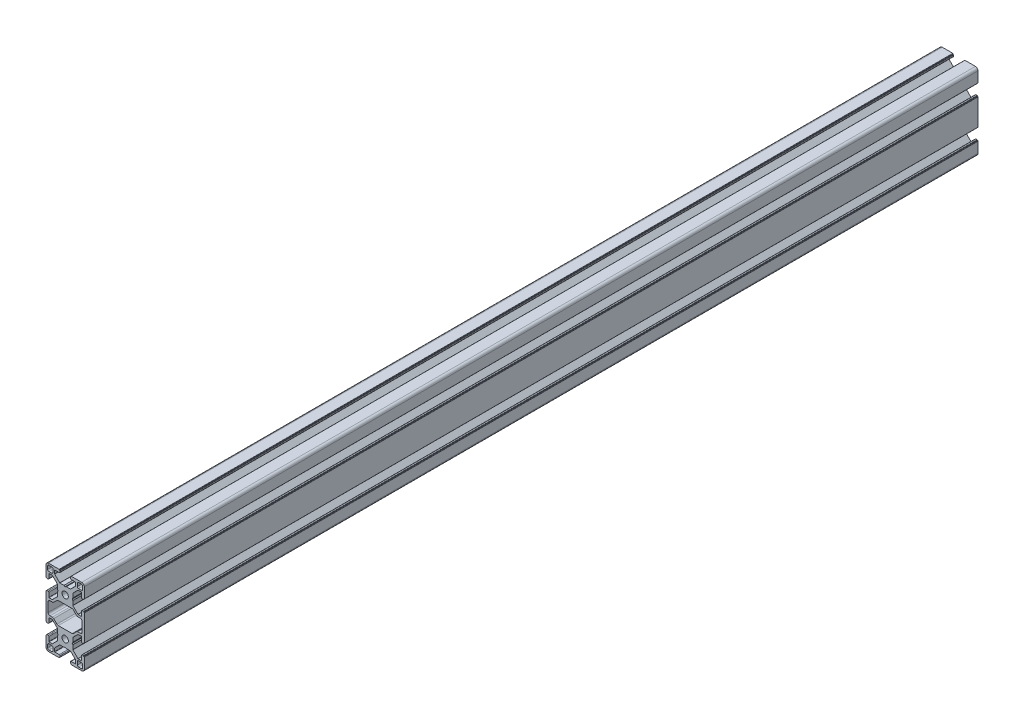
from build123d import *

# Parameters (mm, degrees)
SKETCH1_R                 = 2.45
BOSS_EXTRUDE1_DEPTH       = 700
SKETCH2_R                 = 3
CUT_EXTRUDE1_DEPTH        = 678.163200418
SKETCH3_R                 = 3
CUT_EXTRUDE2_DEPTH        = 678.827411761
M6X1_0_TAPPED_HOLE1_D     = 5
M6X1_0_TAPPED_HOLE1_DEPTH = 28
M6X1_0_TAPPED_HOLE1_TIP   = 1.502151548
M6X1_0_TAPPED_HOLE2_D     = 5
M6X1_0_TAPPED_HOLE2_DEPTH = 28
M6X1_0_TAPPED_HOLE2_TIP   = 1.502151548


with BuildPart() as part:
    # Sketch1 → Boss-Extrude1 (new body)
    with BuildSketch(Plane.XY.offset(25)):
        with BuildLine():
            Line((13.400000821, -25.95), (14.300000334, -25.95))
            ThreePointArc((14.300000334, -25.95), (14.44142169, -25.891421356), (14.500000334, -25.75))
            Line((14.500000334, -25.75), (14.500000334, -25.65))
            ThreePointArc((14.500000334, -25.65), (14.558578978, -25.508578644), (14.700000334, -25.45))
            Line((14.700000334, -25.45), (14.8, -25.45))
            ThreePointArc((14.8, -25.45), (14.941421356, -25.391421356), (15, -25.25))
            Line((15, -25.25), (15, -4.75))
            ThreePointArc((15, -4.75), (14.941421356, -4.608578644), (14.8, -4.55))
            Line((14.8, -4.55), (14.700000334, -4.55))
            ThreePointArc((14.700000334, -4.55), (14.558578978, -4.491421356), (14.500000334, -4.35))
            Line((14.500000334, -4.35), (14.500000334, -4.25))
            ThreePointArc((14.500000334, -4.25), (14.44142169, -4.108578644), (14.300000334, -4.05))
            Line((14.300000334, -4.05), (13.400000821, -4.05))
            ThreePointArc((13.400000821, -4.05), (12.975736752, -4.225735931), (12.800000821, -4.65))
            Line((12.800000821, -4.65), (12.800000821, -8.05))
            ThreePointArc((12.800000821, -8.05), (12.741422177, -8.191421356), (12.600000821, -8.25))
            Line((12.600000821, -8.25), (10.132847586, -8.25))
            ThreePointArc((10.132847586, -8.25), (10.056310912, -8.234775911), (9.991426248, -8.191421374))
            Line((9.991426248, -8.191421374), (6.06304592, -4.263042046))
            ThreePointArc((6.06304592, -4.263042046), (6.019691356, -4.19815737), (6.004467258, -4.121620672))
            Line((6.004467258, -4.121620672), (6.004467258, -0.90000009))
            Line((6.004467258, -0.90000009), (5.542586948, -0.099999736))
            ThreePointArc((5.542586948, -0.099999736), (5.515792105, 0), (5.542586948, 0.099999736))
            Line((5.542586948, 0.099999736), (6.004467258, 0.90000009))
            Line((6.004467258, 0.90000009), (6.004467258, 4.121623437))
            ThreePointArc((6.004467258, 4.121623437), (6.019691347, 4.198160112), (6.063045884, 4.263044775))
            Line((6.063045884, 4.263044775), (9.991421447, 8.191421338))
            ThreePointArc((9.991421447, 8.191421338), (10.056306123, 8.234775902), (10.132842821, 8.25))
            Line((10.132842821, 8.25), (12.600000821, 8.25))
            ThreePointArc((12.600000821, 8.25), (12.741422177, 8.191421356), (12.800000821, 8.05))
            Line((12.800000821, 8.05), (12.800000821, 4.65))
            ThreePointArc((12.800000821, 4.65), (12.975736752, 4.225735931), (13.400000821, 4.05))
            Line((13.400000821, 4.05), (14.300000334, 4.05))
            ThreePointArc((14.300000334, 4.05), (14.44142169, 4.108578644), (14.500000334, 4.25))
            Line((14.500000334, 4.25), (14.500000334, 4.350000125))
            ThreePointArc((14.500000334, 4.350000125), (14.558578978, 4.491421481), (14.700000334, 4.550000125))
            Line((14.700000334, 4.550000125), (14.8, 4.550000125))
            ThreePointArc((14.8, 4.550000125), (14.941421356, 4.608578769), (15, 4.750000125))
            Line((15, 4.750000125), (15, 13))
            ThreePointArc((15, 13), (14.414213562, 14.414213562), (13, 15))
            Line((13, 15), (4.75, 15))
            ThreePointArc((4.75, 15), (4.608578644, 14.941421356), (4.55, 14.8))
            Line((4.55, 14.8), (4.55, 14.7))
            ThreePointArc((4.55, 14.7), (4.491421356, 14.558578644), (4.35, 14.5))
            Line((4.35, 14.5), (4.25, 14.5))
            ThreePointArc((4.25, 14.5), (4.108578644, 14.441421356), (4.05, 14.3))
            Line((4.05, 14.3), (4.05, 13.4))
            ThreePointArc((4.05, 13.4), (4.225735931, 12.975735931), (4.65, 12.8))
            Line((4.65, 12.8), (8.05, 12.8))
            ThreePointArc((8.05, 12.8), (8.191421356, 12.741421356), (8.25, 12.6))
            Line((8.25, 12.6), (8.25, 10.132847492))
            ThreePointArc((8.25, 10.132847492), (8.234775904, 10.056310778), (8.191421344, 9.991426082))
            Line((8.191421344, 9.991426082), (4.258574852, 6.058578588))
            ThreePointArc((4.258574852, 6.058578588), (4.193690258, 6.015224079), (4.117153656, 6))
            Line((4.117153656, 6), (0.899999648, 6))
            Line((0.899999648, 6), (0.101934004, 5.53923672))
            ThreePointArc((0.101934004, 5.53923672), (0, 5.511923593), (-0.101934004, 5.53923672))
            Line((-0.101934004, 5.53923672), (-0.899999648, 6))
            Line((-0.899999648, 6), (-4.117156145, 6))
            ThreePointArc((-4.117156145, 6), (-4.193692724, 6.015224069), (-4.258577305, 6.058578552))
            Line((-4.258577305, 6.058578552), (-8.191421308, 9.991421554))
            ThreePointArc((-8.191421308, 9.991421554), (-8.234775894, 10.056306263), (-8.25, 10.132843))
            Line((-8.25, 10.132843), (-8.25, 12.6))
            ThreePointArc((-8.25, 12.6), (-8.191421356, 12.741421356), (-8.05, 12.8))
            Line((-8.05, 12.8), (-4.65, 12.8))
            ThreePointArc((-4.65, 12.8), (-4.225735931, 12.975735931), (-4.05, 13.4))
            Line((-4.05, 13.4), (-4.05, 14.3))
            ThreePointArc((-4.05, 14.3), (-4.108578644, 14.441421356), (-4.25, 14.5))
            Line((-4.25, 14.5), (-4.35, 14.5))
            ThreePointArc((-4.35, 14.5), (-4.491421356, 14.558578644), (-4.55, 14.7))
            Line((-4.55, 14.7), (-4.55, 14.8))
            ThreePointArc((-4.55, 14.8), (-4.608578644, 14.941421356), (-4.75, 15))
            Line((-4.75, 15), (-13, 15))
            ThreePointArc((-13, 15), (-14.414213562, 14.414213562), (-15, 13))
            Line((-15, 13), (-15, 4.750000125))
            ThreePointArc((-15, 4.750000125), (-14.941421356, 4.608578769), (-14.8, 4.550000125))
            Line((-14.8, 4.550000125), (-14.700000334, 4.550000125))
            ThreePointArc((-14.700000334, 4.550000125), (-14.558578978, 4.491421481), (-14.500000334, 4.350000125))
            Line((-14.500000334, 4.350000125), (-14.500000334, 4.25))
            ThreePointArc((-14.500000334, 4.25), (-14.44142169, 4.108578644), (-14.300000334, 4.05))
            Line((-14.300000334, 4.05), (-13.400000821, 4.05))
            ThreePointArc((-13.400000821, 4.05), (-12.975736752, 4.225735931), (-12.800000821, 4.65))
            Line((-12.800000821, 4.65), (-12.800000821, 8.05))
            ThreePointArc((-12.800000821, 8.05), (-12.741422177, 8.191421356), (-12.600000821, 8.25))
            Line((-12.600000821, 8.25), (-10.132842821, 8.25))
            ThreePointArc((-10.132842821, 8.25), (-10.056306123, 8.234775902), (-9.991421447, 8.191421338))
            Line((-9.991421447, 8.191421338), (-6.063045884, 4.263044775))
            ThreePointArc((-6.063045884, 4.263044775), (-6.019691347, 4.198160112), (-6.004467258, 4.121623437))
            Line((-6.004467258, 4.121623437), (-6.004467258, 0.90000009))
            Line((-6.004467258, 0.90000009), (-5.542586948, 0.099999736))
            ThreePointArc((-5.542586948, 0.099999736), (-5.515792105, 0), (-5.542586948, -0.099999736))
            Line((-5.542586948, -0.099999736), (-6.004467258, -0.90000009))
            Line((-6.004467258, -0.90000009), (-6.004467258, -4.121623437))
            ThreePointArc((-6.004467258, -4.121623437), (-6.019691347, -4.198160112), (-6.063045884, -4.263044775))
            Line((-6.063045884, -4.263044775), (-9.991421447, -8.191421338))
            ThreePointArc((-9.991421447, -8.191421338), (-10.056306123, -8.234775902), (-10.132842821, -8.25))
            Line((-10.132842821, -8.25), (-12.600000821, -8.25))
            ThreePointArc((-12.600000821, -8.25), (-12.741422177, -8.191421356), (-12.800000821, -8.05))
            Line((-12.800000821, -8.05), (-12.800000821, -4.65))
            ThreePointArc((-12.800000821, -4.65), (-12.975736752, -4.225735931), (-13.400000821, -4.05))
            Line((-13.400000821, -4.05), (-14.300000334, -4.05))
            ThreePointArc((-14.300000334, -4.05), (-14.44142169, -4.108578644), (-14.500000334, -4.25))
            Line((-14.500000334, -4.25), (-14.500000334, -4.35))
            ThreePointArc((-14.500000334, -4.35), (-14.558578978, -4.491421356), (-14.700000334, -4.55))
            Line((-14.700000334, -4.55), (-14.8, -4.55))
            ThreePointArc((-14.8, -4.55), (-14.941421356, -4.608578644), (-15, -4.75))
            Line((-15, -4.75), (-15, -25.25))
            ThreePointArc((-15, -25.25), (-14.941421356, -25.391421356), (-14.8, -25.45))
            Line((-14.8, -25.45), (-14.700000334, -25.45))
            ThreePointArc((-14.700000334, -25.45), (-14.558578978, -25.508578644), (-14.500000334, -25.65))
            Line((-14.500000334, -25.65), (-14.500000334, -25.75))
            ThreePointArc((-14.500000334, -25.75), (-14.44142169, -25.891421356), (-14.300000334, -25.95))
            Line((-14.300000334, -25.95), (-13.400000821, -25.95))
            ThreePointArc((-13.400000821, -25.95), (-12.975736752, -25.774264069), (-12.800000821, -25.35))
            Line((-12.800000821, -25.35), (-12.800000821, -21.95))
            ThreePointArc((-12.800000821, -21.95), (-12.741422177, -21.808578644), (-12.600000821, -21.75))
            Line((-12.600000821, -21.75), (-10.132842821, -21.75))
            ThreePointArc((-10.132842821, -21.75), (-10.056306123, -21.765224098), (-9.991421447, -21.808578662))
            Line((-9.991421447, -21.808578662), (-6.063045884, -25.736955225))
            ThreePointArc((-6.063045884, -25.736955225), (-6.019691347, -25.801839888), (-6.004467258, -25.878376563))
            Line((-6.004467258, -25.878376563), (-6.004467258, -29.09999991))
            Line((-6.004467258, -29.09999991), (-5.542586948, -29.900000264))
            ThreePointArc((-5.542586948, -29.900000264), (-5.515792105, -30), (-5.542586948, -30.099999736))
            Line((-5.542586948, -30.099999736), (-6.004467258, -30.90000009))
            Line((-6.004467258, -30.90000009), (-6.004467258, -34.121623437))
            ThreePointArc((-6.004467258, -34.121623437), (-6.019691347, -34.198160112), (-6.063045884, -34.263044775))
            Line((-6.063045884, -34.263044775), (-9.991421447, -38.191421338))
            ThreePointArc((-9.991421447, -38.191421338), (-10.056306123, -38.234775902), (-10.132842821, -38.25))
            Line((-10.132842821, -38.25), (-12.600000821, -38.25))
            ThreePointArc((-12.600000821, -38.25), (-12.741422177, -38.191421356), (-12.800000821, -38.05))
            Line((-12.800000821, -38.05), (-12.800000821, -34.65))
            ThreePointArc((-12.800000821, -34.65), (-12.975736752, -34.225735931), (-13.400000821, -34.05))
            Line((-13.400000821, -34.05), (-14.300000334, -34.05))
            ThreePointArc((-14.300000334, -34.05), (-14.44142169, -34.108578644), (-14.500000334, -34.25))
            Line((-14.500000334, -34.25), (-14.500000334, -34.350000125))
            ThreePointArc((-14.500000334, -34.350000125), (-14.558578978, -34.491421481), (-14.700000334, -34.550000125))
            Line((-14.700000334, -34.550000125), (-14.8, -34.550000125))
            ThreePointArc((-14.8, -34.550000125), (-14.941421356, -34.608578769), (-15, -34.750000125))
            Line((-15, -34.750000125), (-15, -43))
            ThreePointArc((-15, -43), (-14.414213562, -44.414213562), (-13, -45))
            Line((-13, -45), (-4.75, -45))
            ThreePointArc((-4.75, -45), (-4.608578644, -44.941421356), (-4.55, -44.8))
            Line((-4.55, -44.8), (-4.55, -44.7))
            ThreePointArc((-4.55, -44.7), (-4.491421356, -44.558578644), (-4.35, -44.5))
            Line((-4.35, -44.5), (-4.25, -44.5))
            ThreePointArc((-4.25, -44.5), (-4.108578644, -44.441421356), (-4.05, -44.3))
            Line((-4.05, -44.3), (-4.05, -43.4))
            ThreePointArc((-4.05, -43.4), (-4.225735931, -42.975735931), (-4.65, -42.8))
            Line((-4.65, -42.8), (-8.05, -42.8))
            ThreePointArc((-8.05, -42.8), (-8.191421356, -42.741421356), (-8.25, -42.6))
            Line((-8.25, -42.6), (-8.25, -40.132843))
            ThreePointArc((-8.25, -40.132843), (-8.234775894, -40.056306263), (-8.191421308, -39.991421554))
            Line((-8.191421308, -39.991421554), (-4.258577305, -36.058578552))
            ThreePointArc((-4.258577305, -36.058578552), (-4.193692724, -36.015224069), (-4.117156145, -36))
            Line((-4.117156145, -36), (-0.899999648, -36))
            Line((-0.899999648, -36), (-0.101934004, -35.53923672))
            ThreePointArc((-0.101934004, -35.53923672), (0, -35.511923593), (0.101934004, -35.53923672))
            Line((0.101934004, -35.53923672), (0.899999648, -36))
            Line((0.899999648, -36), (4.117153656, -36))
            ThreePointArc((4.117153656, -36), (4.193690258, -36.015224079), (4.258574852, -36.058578588))
            Line((4.258574852, -36.058578588), (8.191421344, -39.991426082))
            ThreePointArc((8.191421344, -39.991426082), (8.234775904, -40.056310778), (8.25, -40.132847492))
            Line((8.25, -40.132847492), (8.25, -42.6))
            ThreePointArc((8.25, -42.6), (8.191421356, -42.741421356), (8.05, -42.8))
            Line((8.05, -42.8), (4.65, -42.8))
            ThreePointArc((4.65, -42.8), (4.225735931, -42.975735931), (4.05, -43.4))
            Line((4.05, -43.4), (4.05, -44.3))
            ThreePointArc((4.05, -44.3), (4.108578644, -44.441421356), (4.25, -44.5))
            Line((4.25, -44.5), (4.35, -44.5))
            ThreePointArc((4.35, -44.5), (4.491421356, -44.558578644), (4.55, -44.7))
            Line((4.55, -44.7), (4.55, -44.8))
            ThreePointArc((4.55, -44.8), (4.608578644, -44.941421356), (4.75, -45))
            Line((4.75, -45), (13, -45))
            ThreePointArc((13, -45), (14.414213562, -44.414213562), (15, -43))
            Line((15, -43), (15, -34.750000125))
            ThreePointArc((15, -34.750000125), (14.941421356, -34.608578769), (14.8, -34.550000125))
            Line((14.8, -34.550000125), (14.700000334, -34.550000125))
            ThreePointArc((14.700000334, -34.550000125), (14.558578978, -34.491421481), (14.500000334, -34.350000125))
            Line((14.500000334, -34.350000125), (14.500000334, -34.25))
            ThreePointArc((14.500000334, -34.25), (14.44142169, -34.108578644), (14.300000334, -34.05))
            Line((14.300000334, -34.05), (13.400000821, -34.05))
            ThreePointArc((13.400000821, -34.05), (12.975736752, -34.225735931), (12.800000821, -34.65))
            Line((12.800000821, -34.65), (12.800000821, -38.05))
            ThreePointArc((12.800000821, -38.05), (12.741422177, -38.191421356), (12.600000821, -38.25))
            Line((12.600000821, -38.25), (10.132842821, -38.25))
            ThreePointArc((10.132842821, -38.25), (10.056306123, -38.234775902), (9.991421447, -38.191421338))
            Line((9.991421447, -38.191421338), (6.063045884, -34.263044775))
            ThreePointArc((6.063045884, -34.263044775), (6.019691347, -34.198160112), (6.004467258, -34.121623437))
            Line((6.004467258, -34.121623437), (6.004467258, -30.90000009))
            Line((6.004467258, -30.90000009), (5.542586948, -30.099999736))
            ThreePointArc((5.542586948, -30.099999736), (5.515792105, -30), (5.542586948, -29.900000264))
            Line((5.542586948, -29.900000264), (6.004467258, -29.09999991))
            Line((6.004467258, -29.09999991), (6.004467258, -25.878379328))
            ThreePointArc((6.004467258, -25.878379328), (6.019691356, -25.80184263), (6.06304592, -25.736957954))
            Line((6.06304592, -25.736957954), (9.991426248, -21.808578626))
            ThreePointArc((9.991426248, -21.808578626), (10.056310912, -21.765224089), (10.132847586, -21.75))
            Line((10.132847586, -21.75), (12.600000821, -21.75))
            ThreePointArc((12.600000821, -21.75), (12.741422177, -21.808578644), (12.800000821, -21.95))
            Line((12.800000821, -21.95), (12.800000821, -25.35))
            ThreePointArc((12.800000821, -25.35), (12.975736752, -25.774264069), (13.400000821, -25.95))
        make_face()
        Circle(SKETCH1_R, mode=Mode.SUBTRACT)
        with Locations((0, -30)):
            Circle(SKETCH1_R, mode=Mode.SUBTRACT)
        with BuildLine():
            Line((-9.500000904, 12.700000174), (-9.500000904, 10.500000174))
            ThreePointArc((-9.500000904, 10.500000174), (-9.792894123, 9.792893393), (-10.500000904, 9.500000174))
            Line((-10.500000904, 9.500000174), (-12.700000904, 9.500000174))
            ThreePointArc((-12.700000904, 9.500000174), (-13.407107685, 9.792893393), (-13.700000904, 10.500000174))
            Line((-13.700000904, 10.500000174), (-13.700000904, 12.700000174))
            ThreePointArc((-13.700000904, 12.700000174), (-13.407107685, 13.407106955), (-12.700000904, 13.700000174))
            Line((-12.700000904, 13.700000174), (-10.500000904, 13.700000174))
            ThreePointArc((-10.500000904, 13.700000174), (-9.792894123, 13.407106955), (-9.500000904, 12.700000174))
        make_face(mode=Mode.SUBTRACT)
        with BuildLine():
            Line((12.700000904, 9.500000174), (10.500000904, 9.500000174))
            ThreePointArc((10.500000904, 9.500000174), (9.792894123, 9.792893393), (9.500000904, 10.500000174))
            Line((9.500000904, 10.500000174), (9.500000904, 12.700000174))
            ThreePointArc((9.500000904, 12.700000174), (9.792894123, 13.407106955), (10.500000904, 13.700000174))
            Line((10.500000904, 13.700000174), (12.700000904, 13.700000174))
            ThreePointArc((12.700000904, 13.700000174), (13.407107685, 13.407106955), (13.700000904, 12.700000174))
            Line((13.700000904, 12.700000174), (13.700000904, 10.500000174))
            ThreePointArc((13.700000904, 10.500000174), (13.407107685, 9.792893393), (12.700000904, 9.500000174))
        make_face(mode=Mode.SUBTRACT)
        with BuildLine():
            Line((-12.700000904, -39.500000174), (-10.500000904, -39.500000174))
            ThreePointArc((-10.500000904, -39.500000174), (-9.792894123, -39.792893393), (-9.500000904, -40.500000174))
            Line((-9.500000904, -40.500000174), (-9.500000904, -42.700000174))
            ThreePointArc((-9.500000904, -42.700000174), (-9.792894123, -43.407106955), (-10.500000904, -43.700000174))
            Line((-10.500000904, -43.700000174), (-12.700000904, -43.700000174))
            ThreePointArc((-12.700000904, -43.700000174), (-13.407107685, -43.407106955), (-13.700000904, -42.700000174))
            Line((-13.700000904, -42.700000174), (-13.700000904, -40.500000174))
            ThreePointArc((-13.700000904, -40.500000174), (-13.407107685, -39.792893393), (-12.700000904, -39.500000174))
        make_face(mode=Mode.SUBTRACT)
        with BuildLine():
            Line((9.500000904, -42.700000174), (9.500000904, -40.500000174))
            ThreePointArc((9.500000904, -40.500000174), (9.792894123, -39.792893393), (10.500000904, -39.500000174))
            Line((10.500000904, -39.500000174), (12.700000904, -39.500000174))
            ThreePointArc((12.700000904, -39.500000174), (13.407107685, -39.792893393), (13.700000904, -40.500000174))
            Line((13.700000904, -40.500000174), (13.700000904, -42.700000174))
            ThreePointArc((13.700000904, -42.700000174), (13.407107685, -43.407106955), (12.700000904, -43.700000174))
            Line((12.700000904, -43.700000174), (10.500000904, -43.700000174))
            ThreePointArc((10.500000904, -43.700000174), (9.792894123, -43.407106955), (9.500000904, -42.700000174))
        make_face(mode=Mode.SUBTRACT)
        with BuildLine():
            Line((8.927207746, -20.539339865), (6.410354062, -23.056193892))
            ThreePointArc((6.410354062, -23.056193892), (5.923719014, -23.381353072), (5.349693818, -23.495533793))
            Line((5.349693818, -23.495533793), (-5.349693818, -23.495533793))
            ThreePointArc((-5.349693818, -23.495533793), (-5.923719014, -23.381353072), (-6.410354062, -23.056193892))
            Line((-6.410354062, -23.056193892), (-8.927207746, -20.539339865))
            ThreePointArc((-8.927207746, -20.539339865), (-9.413842755, -20.214180712), (-9.987867904, -20.1))
            Line((-9.987867904, -20.1), (-11.849999904, -20.1))
            ThreePointArc((-11.849999904, -20.1), (-12.910660076, -19.660660172), (-13.349999904, -18.6))
            Line((-13.349999904, -18.6), (-13.349999904, -11.4))
            ThreePointArc((-13.349999904, -11.4), (-12.910660076, -10.339339828), (-11.849999904, -9.9))
            Line((-11.849999904, -9.9), (-9.987867904, -9.9))
            ThreePointArc((-9.987867904, -9.9), (-9.413842755, -9.785819288), (-8.927207746, -9.460660135))
            Line((-8.927207746, -9.460660135), (-6.410354062, -6.943806108))
            ThreePointArc((-6.410354062, -6.943806108), (-5.923719014, -6.618646928), (-5.349693818, -6.504466207))
            Line((-5.349693818, -6.504466207), (5.349693818, -6.504466207))
            ThreePointArc((5.349693818, -6.504466207), (5.923719014, -6.618646928), (6.410354062, -6.943806108))
            Line((6.410354062, -6.943806108), (8.927207746, -9.460660135))
            ThreePointArc((8.927207746, -9.460660135), (9.413842755, -9.785819288), (9.987867904, -9.9))
            Line((9.987867904, -9.9), (11.849999904, -9.9))
            ThreePointArc((11.849999904, -9.9), (12.910660076, -10.339339828), (13.349999904, -11.4))
            Line((13.349999904, -11.4), (13.349999904, -18.6))
            ThreePointArc((13.349999904, -18.6), (12.910660076, -19.660660172), (11.849999904, -20.1))
            Line((11.849999904, -20.1), (9.987867904, -20.1))
            ThreePointArc((9.987867904, -20.1), (9.413842755, -20.214180712), (8.927207746, -20.539339865))
        make_face(mode=Mode.SUBTRACT)
    extrude(amount=-BOSS_EXTRUDE1_DEPTH)

    # Sketch2 → Cut-Extrude1 (cut, through all)
    with BuildSketch(Plane(origin=(15, 0, 0), x_dir=(0, 0, -1), z_dir=(1, 0, 0))):
        with Locations((20, 0)):
            Circle(SKETCH2_R)
        with Locations((20, -30)):
            Circle(SKETCH2_R)
        with Locations((660, 0)):
            Circle(SKETCH2_R)
        with Locations((660, -30)):
            Circle(SKETCH2_R)
    extrude(amount=-CUT_EXTRUDE1_DEPTH, mode=Mode.SUBTRACT)

    # Sketch3 → Cut-Extrude2 (cut, through all)
    with BuildSketch(Plane.XZ.offset(45)):
        with Locations((0, -20)):
            Circle(SKETCH3_R)
        with Locations((0, -660)):
            Circle(SKETCH3_R)
    extrude(amount=-CUT_EXTRUDE2_DEPTH, mode=Mode.SUBTRACT)

    # M6x1.0 Tapped Hole1
    with Locations(Plane.XY.offset(25)):
        with Locations((0, 0), (0, -30)):
            Hole(M6X1_0_TAPPED_HOLE1_D / 2, depth=M6X1_0_TAPPED_HOLE1_DEPTH)
            with Locations((0, 0, -(M6X1_0_TAPPED_HOLE1_DEPTH + M6X1_0_TAPPED_HOLE1_TIP / 2))):  # 118° drill point
                Cone(0, M6X1_0_TAPPED_HOLE1_D / 2, M6X1_0_TAPPED_HOLE1_TIP, mode=Mode.SUBTRACT)

    # M6x1.0 Tapped Hole2
    with Locations(Plane(origin=(0, 0, -675), x_dir=(-1, 0, 0), z_dir=(0, 0, -1))):
        with Locations((0, 0), (0, -30)):
            Hole(M6X1_0_TAPPED_HOLE2_D / 2, depth=M6X1_0_TAPPED_HOLE2_DEPTH)
            with Locations((0, 0, -(M6X1_0_TAPPED_HOLE2_DEPTH + M6X1_0_TAPPED_HOLE2_TIP / 2))):  # 118° drill point
                Cone(0, M6X1_0_TAPPED_HOLE2_D / 2, M6X1_0_TAPPED_HOLE2_TIP, mode=Mode.SUBTRACT)


solid = part.part
